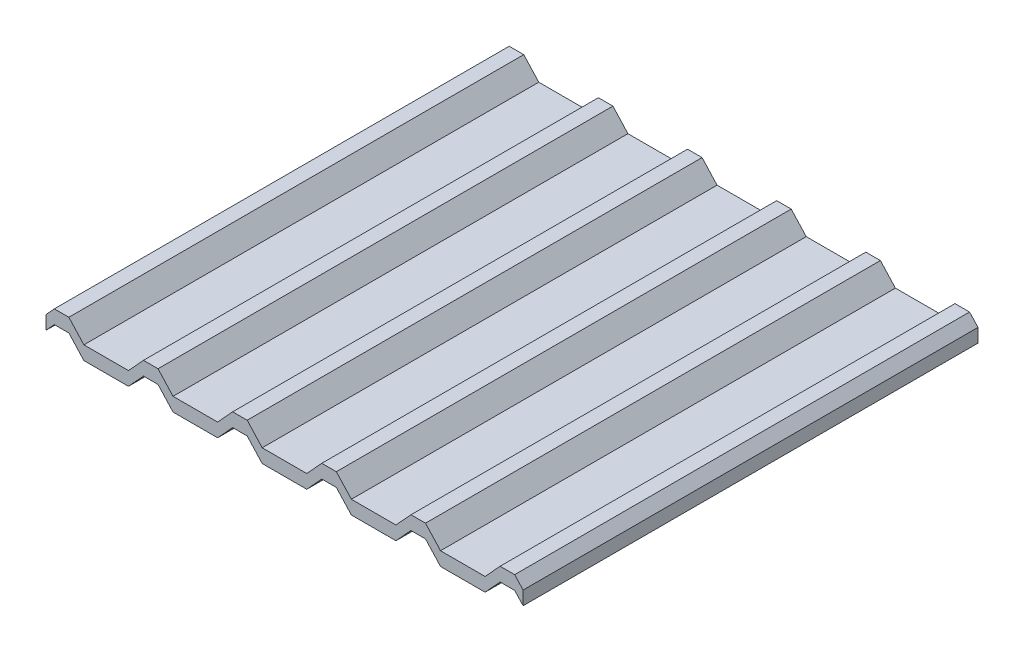
from build123d import *

# Parameters (mm, degrees)
RESSALTO_EXTRUS_O1_DEPTH = 1000


with BuildPart() as part:
    # Esboço1 → Ressalto-extrusão1 (new body)
    with BuildSketch(Plane.XY):
        Polygon((0, 0), (32, 0), (65, -36), (163, -36), (196, 0), (228, 0), (261, -36), (359, -36), (392, 0), (424, 0), (457, -36), (555, -36), (588, 0), (620, 0), (653, -36), (751, -36), (784, 0), (816, 0), (834.566797067, -20), (834.566797067, 10), (816, 30), (784, 30), (751, -6), (653, -6), (620, 30), (588, 30), (555, -6), (457, -6), (424, 30), (392, 30), (359, -6), (261, -6), (228, 30), (196, 30), (163, -6), (65, -6), (32, 30), (0, 30), (-33, -6), (-131, -6), (-164, 30), (-196, 30), (-214.272936105, 10), (-214.272936105, -20), (-196, 0), (-164, 0), (-131, -36), (-33, -36), align=None)
    extrude(amount=RESSALTO_EXTRUS_O1_DEPTH)


solid = part.part
